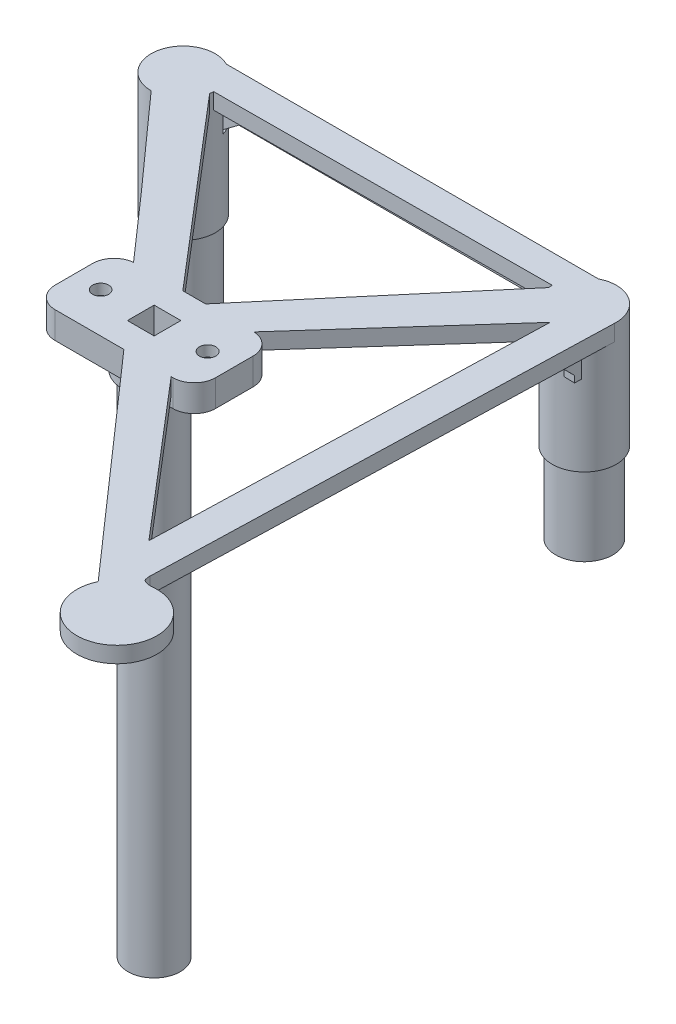
from build123d import *
from build123d.topology import SkipClean

# Parameters (mm, degrees)
EXTRUDE_1_DEPTH          = 3
SKETCH_2_R               = 5.35
EXTRUDE_2_DEPTH          = 23
CUT_EXTRUDE_1_DEPTH      = 3
SKETCH_4_R               = 5
EXTRUDE_3_DEPTH          = 100
EXTRUDE_START            = 3
SKETCH_5_R               = 5
EXTRUDE_4_DEPTH          = 3
SKETCH_6_R               = 5.35
EXTRUDE_5_DEPTH          = 5
SKETCH_7_R               = 5.35
EXTRUDE_6_DEPTH          = 5
SKETCH_8_W               = 75
SKETCH_8_H               = 10.7
EXTRUDE_7_DEPTH          = 3
EXTRUDE_8_DEPTH          = 3
CUT_EXTRUDE_2_DEPTH      = 3
SKETCH_12_R              = 6
EXTRUDE_10_DEPTH         = 13
SKETCH_13_R              = 3
CUT_EXTRUDE_3_DEPTH      = 23
SKETCH_14_R              = 3.125
CUT_EXTRUDE_5_DEPTH      = 100
SKETCH_15_R              = 6
SKETCH_15_R_2            = 5.35
EXTRUDE_11_DEPTH         = 5
SKETCH_16_R              = 6
SKETCH_16_R_2            = 3
EXTRUDE_12_DEPTH         = 5
SKETCH_17_R              = 5.35
SKETCH_17_R_2            = 3
EXTRUDE_13_DEPTH         = 5
SKETCH_18_R              = 5.35
SKETCH_18_R_2            = 3
EXTRUDE_14_DEPTH         = 5
SKETCH_20_R              = 6
SKETCH_20_R_2            = 5.35
EXTRUDE_15_DEPTH         = 5
SKETCH_21_R              = 6
SKETCH_21_R_2            = 5.35
EXTRUDE_16_DEPTH         = 5
SKETCH_22_R              = 5.35
SKETCH_22_R_2            = 3
EXTRUDE_17_DEPTH         = 5
SKETCH_23_R              = 5.35
SKETCH_23_R_2            = 3
EXTRUDE_18_DEPTH         = 5
SKETCH_25_R              = 7.5
EXTRUDE_20_DEPTH         = 3
EXTRUDE_21_DEPTH         = 3
EXTRUDE_23_DEPTH         = 3
SKETCH_30_R              = 7.5
EXTRUDE_24_DEPTH         = 3
FILLET_1_R               = 3
EXTRUDE_29_DEPTH         = 5
EXTRUDE_31_DEPTH         = 2
SKETCH_50_R              = 5.998205811
EXTRUDE_32_DEPTH         = 103
CUT_EXTRUDE_START        = -95
SKETCH_52_R              = 5.998205811
SKETCH_52_R_2            = 4.9
CUT_EXTRUDE_7_DEPTH      = 95
CUT_EXTRUDE_START_2      = -44
SKETCH_53_R              = 4.9
CUT_EXTRUDE_8_DEPTH      = 44
SKETCH_54_R              = 1.5
EXTRUDE_33_DEPTH         = 5
CUT_EXTRUDE_9_DEPTH      = 56
CUT_EXTRUDE_START_3      = -6
SKETCH_56_R              = 1.5
CUT_EXTRUDE_10_DEPTH     = 6
SKETCH_57_R              = 15
EXTRUDE_34_DEPTH         = 3
SKETCH_58_R              = 4.9
EXTRUDE_35_DEPTH         = 51
CUT_EXTRUDE_11_DEPTH     = 5
SKETCH_60_R              = 2.75
CUT_EXTRUDE_12_DEPTH     = 46
SKETCH_61_R              = 1.5
CUT_EXTRUDE_13_DEPTH     = 9
CUT_EXTRUDE_14_DEPTH     = 1.65
SKETCH_63_R              = 1
CUT_EXTRUDE_15_DEPTH     = 1.5
PATTERN_CIRCULAR_1_COUNT = 8
SKETCH_64_R              = 3.175426481
CUT_EXTRUDE_17_DEPTH     = 5
CUT_EXTRUDE_18_DEPTH     = 56
FILLET_2_R               = 1
EXTRUDE_36_DEPTH         = 5
SKETCH_67_R              = 1.5
CUT_EXTRUDE_19_DEPTH     = 5
FILLET_3_R               = 1
SKETCH_69_R              = 4.9
EXTRUDE_37_DEPTH         = 3
CUT_EXTRUDE_20_DEPTH     = 3
CUT_EXTRUDE_21_DEPTH     = 3
SKETCH_71_R              = 2.9
CUT_EXTRUDE_22_DEPTH     = 46
FILLET_4_R               = 1
SKETCH_72_R              = 1.742227019
CUT_EXTRUDE_23_DEPTH     = 3
SKETCH_73_R              = 4.9
CUT_EXTRUDE_24_DEPTH     = 10
EXTRUDE_START_2          = -59
SKETCH_74_R              = 4.9
EXTRUDE_38_DEPTH         = 59
SKETCH_75_W              = 5
SKETCH_75_H              = 5
CUT_EXTRUDE_25_DEPTH     = 59
SKETCH_76_R              = 4.9
SKETCH_76_W              = 5
SKETCH_76_H              = 5
EXTRUDE_39_DEPTH         = 44
SKETCH_77_R              = 19.817326089
CUT_EXTRUDE_27_DEPTH     = 64
SKETCH_78_W              = 30
SKETCH_78_H              = 15
EXTRUDE_40_DEPTH         = 5
FILLET_5_R               = 4
CUT_EXTRUDE_28_DEPTH     = 3
SKETCH_81_R              = 1.5
SKETCH_81_R_2            = 1.524054251
CUT_EXTRUDE_29_DEPTH     = 3
SKETCH_83_W              = 5
SKETCH_83_H              = 5
CUT_EXTRUDE_30_DEPTH     = 5


with BuildPart() as part:
    # 草图1 → 凸台-拉伸1 (new body)
    with BuildSketch(Plane(origin=(0, 0, 0), x_dir=(1, 0, 0), z_dir=(0, 1, 0))):
        Polygon((-18.65535641, 0), (18.84464359, -42.930983399), (56.34464359, 0), align=None)
    extrude(amount=EXTRUDE_1_DEPTH)

    # 草图2 → 凸台-拉伸2 (add)
    with BuildSketch(Plane(origin=(0, 3, 0), x_dir=(1, 0, 0), z_dir=(0, 1, 0))):
        with Locations(Location((56.34464359, 0, 0), (0, 0, 270))):
            Circle(SKETCH_2_R)
        with Locations(Location((-18.65535641, 0, 0), (0, 0, 270))):
            Circle(SKETCH_2_R)
    extrude(amount=-EXTRUDE_2_DEPTH)

    # 草图3 → 切除-拉伸1 (cut)
    with BuildSketch(Plane.XZ):
        Polygon((8.632668758, 17.559374543), (1.15609776, 9), (33.75905687, 9), (36.53318942, 9), (29.056618422, 17.559374543), (18.84464359, 29.25031113), align=None)
    extrude(amount=-CUT_EXTRUDE_1_DEPTH, mode=Mode.SUBTRACT)

    # 草图4 → 凸台-拉伸3 (add)
    with BuildSketch(Plane.XZ):
        with Locations(Location((18.84464359, 42.930983399, 0), (0, 0, 228.862949093))):
            Circle(SKETCH_4_R)
    extrude(amount=EXTRUDE_3_DEPTH)

    # 草图5 → 凸台-拉伸4 (add)
    with BuildSketch(Plane(origin=(0, 0, 0), x_dir=(1, 0, 0), z_dir=(0, 1, 0)).offset(EXTRUDE_START)):
        with Locations(Location((18.84464359, -42.930983399, 0), (0, 0, 131.137050907))):
            Circle(SKETCH_5_R)
    extrude(amount=-EXTRUDE_4_DEPTH)

    # 草图6 → 凸台-拉伸5 (add)
    with SkipClean():  # the faces are left unmerged after this step: merging them gives an invalid solid
        with BuildSketch(Plane.XZ.offset(20)):
            with Locations(Location((56.34464359, 0, 0), (0, 0, 131.137050907))):
                Circle(SKETCH_6_R)
        extrude(amount=EXTRUDE_5_DEPTH)
    add(part.part.scale(1), mode=Mode.REPLACE)  # the faces are merged on a copy

    # 草图7 → 凸台-拉伸6 (add)
    with BuildSketch(Plane.XZ.offset(20)):
        with Locations(Location((-18.65535641, 0, 0), (0, 0, 48.862949093))):
            Circle(SKETCH_7_R)
    extrude(amount=EXTRUDE_6_DEPTH)

    # 草图8 → 凸台-拉伸7 (add)
    with SkipClean():  # the faces are left unmerged after this step: merging them gives an invalid solid
        with BuildSketch(Plane(origin=(0, 3, 0), x_dir=(1, 0, 0), z_dir=(0, 1, 0))):
            with Locations((18.84464359, 0)):
                Rectangle(SKETCH_8_W, SKETCH_8_H)
        extrude(amount=-EXTRUDE_7_DEPTH)

    # 草图9 → 凸台-拉伸8 (add)
    with SkipClean():  # the faces are left unmerged after this step: merging them gives an invalid solid
        with BuildSketch(Plane(origin=(0, 3, 0), x_dir=(1, 0, 0), z_dir=(0, 1, 0))):
            Polygon((61.69464359, 0), (18.84464359, -47.930983399), (-24.00535641, 0), align=None)
        extrude(amount=-EXTRUDE_8_DEPTH)

    # 草图10 → 切除-拉伸2 (cut)
    with SkipClean():  # the faces are left unmerged after this step: merging them gives an invalid solid
        with BuildSketch(Plane.XZ):
            Polygon((18.84464359, 37.930983399), (-13.313716495, 0.298969924), (50.99464359, 0), align=None)
        extrude(amount=-CUT_EXTRUDE_2_DEPTH, mode=Mode.SUBTRACT)

    # 草图12 → 凸台-拉伸10 (add)
    with SkipClean():  # the faces are left unmerged after this step: merging them gives an invalid solid
        with BuildSketch(Plane(origin=(0, 3, 0), x_dir=(1, 0, 0), z_dir=(0, 1, 0))):
            with Locations(Location((-18.65535641, 0, 0), (0, 0, 270))):
                Circle(SKETCH_12_R)
            with Locations(Location((56.34464359, 0, 0), (0, 0, 270))):
                Circle(SKETCH_12_R)
        extrude(amount=-EXTRUDE_10_DEPTH)

    # 草图13 → 切除-拉伸3 (cut)
    with SkipClean():  # the faces are left unmerged after this step: merging them gives an invalid solid
        with BuildSketch(Plane.XZ.offset(25)):
            with Locations(Location((-18.65535641, 0, 0), (0, 0, 270))):
                Circle(SKETCH_13_R)
            with Locations(Location((56.34464359, 0, 0), (0, 0, 270))):
                Circle(SKETCH_13_R)
        extrude(amount=-CUT_EXTRUDE_3_DEPTH, mode=Mode.SUBTRACT)

    # 草图14 → 切除-拉伸5 (cut)
    with SkipClean():  # the faces are left unmerged after this step: merging them gives an invalid solid
        with BuildSketch(Plane.XZ.offset(100)):
            with Locations(Location((18.84464359, 42.930983399, 0), (0, 0, 270))):
                Circle(SKETCH_14_R)
        extrude(amount=-CUT_EXTRUDE_5_DEPTH, mode=Mode.SUBTRACT)

    # 草图15 → 凸台-拉伸11 (add)
    with SkipClean():  # the faces are left unmerged after this step: merging them gives an invalid solid
        with BuildSketch(Plane.XZ.offset(10)):
            with Locations(Location((56.34464359, 0, 0), (0, 0, 90.133194259))):
                Circle(SKETCH_15_R)
            with Locations(Location((56.34464359, 0, 0), (0, 0, 270))):
                Circle(SKETCH_15_R_2, mode=Mode.SUBTRACT)
        extrude(amount=EXTRUDE_11_DEPTH)

    # 草图16 → 凸台-拉伸12 (add)
    with SkipClean():  # the faces are left unmerged after this step: merging them gives an invalid solid
        with BuildSketch(Plane.XZ.offset(10)):
            with Locations(Location((-18.65535641, 0, 0), (0, 0, 89.866805741))):
                Circle(SKETCH_16_R)
            with Locations(Location((-18.65535641, 0, 0), (0, 0, 270))):
                Circle(SKETCH_16_R_2, mode=Mode.SUBTRACT)
        extrude(amount=EXTRUDE_12_DEPTH)

    # 草图17 → 凸台-拉伸13 (add)
    with SkipClean():  # the faces are left unmerged after this step: merging them gives an invalid solid
        with BuildSketch(Plane.XZ.offset(25)):
            with Locations(Location((-18.65535641, 0, 0), (0, 0, 270))):
                Circle(SKETCH_17_R)
            with Locations(Location((-18.65535641, 0, 0), (0, 0, 270))):
                Circle(SKETCH_17_R_2, mode=Mode.SUBTRACT)
        extrude(amount=EXTRUDE_13_DEPTH)

    # 草图18 → 凸台-拉伸14 (add)
    with SkipClean():  # the faces are left unmerged after this step: merging them gives an invalid solid
        with BuildSketch(Plane.XZ.offset(25)):
            with Locations(Location((56.34464359, 0, 0), (0, 0, 270))):
                Circle(SKETCH_18_R)
            with Locations(Location((56.34464359, 0, 0), (0, 0, 270))):
                Circle(SKETCH_18_R_2, mode=Mode.SUBTRACT)
        extrude(amount=EXTRUDE_14_DEPTH)

    # 草图20 → 凸台-拉伸15 (add)
    with SkipClean():  # the faces are left unmerged after this step: merging them gives an invalid solid
        with BuildSketch(Plane.XZ.offset(15)):
            with Locations(Location((-18.65535641, 0, 0), (0, 0, 89.866805741))):
                Circle(SKETCH_20_R)
            with Locations(Location((-18.65535641, 0, 0), (0, 0, 270))):
                Circle(SKETCH_20_R_2, mode=Mode.SUBTRACT)
        extrude(amount=EXTRUDE_15_DEPTH)

    # 草图21 → 凸台-拉伸16 (add)
    with SkipClean():  # the faces are left unmerged after this step: merging them gives an invalid solid
        with BuildSketch(Plane.XZ.offset(15)):
            with Locations(Location((56.34464359, 0, 0), (0, 0, 90.133194259))):
                Circle(SKETCH_21_R)
            with Locations(Location((56.34464359, 0, 0), (0, 0, 270))):
                Circle(SKETCH_21_R_2, mode=Mode.SUBTRACT)
        extrude(amount=EXTRUDE_16_DEPTH)

    # 草图22 → 凸台-拉伸17 (add)
    with SkipClean():  # the faces are left unmerged after this step: merging them gives an invalid solid
        with BuildSketch(Plane.XZ.offset(30)):
            with Locations(Location((-18.65535641, 0, 0), (0, 0, 270))):
                Circle(SKETCH_22_R)
            with Locations(Location((-18.65535641, 0, 0), (0, 0, 270))):
                Circle(SKETCH_22_R_2, mode=Mode.SUBTRACT)
        extrude(amount=EXTRUDE_17_DEPTH)

    # 草图23 → 凸台-拉伸18 (add)
    with SkipClean():  # the faces are left unmerged after this step: merging them gives an invalid solid
        with BuildSketch(Plane.XZ.offset(30)):
            with Locations(Location((56.34464359, 0, 0), (0, 0, 270))):
                Circle(SKETCH_23_R)
            with Locations(Location((56.34464359, 0, 0), (0, 0, 270))):
                Circle(SKETCH_23_R_2, mode=Mode.SUBTRACT)
        extrude(amount=EXTRUDE_18_DEPTH)

    # 草图25 → 凸台-拉伸20 (add)
    with SkipClean():  # the faces are left unmerged after this step: merging them gives an invalid solid
        with BuildSketch(Plane(origin=(0, 3, 0), x_dir=(1, 0, 0), z_dir=(0, 1, 0))):
            with Locations((18.84464359, -42.930983399)):
                Circle(SKETCH_25_R)
        extrude(amount=-EXTRUDE_20_DEPTH)

    # 草图28 → 凸台-拉伸21 (add)
    with SkipClean():  # the faces are left unmerged after this step: merging them gives an invalid solid
        with BuildSketch(Plane(origin=(0, 3, 0), x_dir=(1, 0, 0), z_dir=(0, 1, 0))):
            Polygon((-3.379636645, -23.071435978), (2.093554995, -18.328702995), (68.652557408, -96.216669577), (66.868599364, -97.910067347), (64.321605904, -100.026810209), align=None)
        extrude(amount=-EXTRUDE_21_DEPTH)

    # 草图29 → 凸台-拉伸23 (add)
    with SkipClean():  # the faces are left unmerged after this step: merging them gives an invalid solid
        with BuildSketch(Plane(origin=(0, 3, 0), x_dir=(1, 0, 0), z_dir=(0, 1, 0))):
            Polygon((56.34464359, 0), (53.74105837, -88), (59.74105837, -88), (62.34464359, 0), align=None)
        extrude(amount=-EXTRUDE_23_DEPTH)

    # 草图30 → 凸台-拉伸24 (add)
    with SkipClean():  # the faces are left unmerged after this step: merging them gives an invalid solid
        with BuildSketch(Plane(origin=(0, 3, 0), x_dir=(1, 0, 0), z_dir=(0, 1, 0))):
            with Locations((62.6531538, -93.694621783)):
                Circle(SKETCH_30_R)
        extrude(amount=-EXTRUDE_24_DEPTH)

    # 圆角1
    # the kernel refuses this fillet: 3 mm, written as the material it adds along each edge
    with BuildSketch(Plane(origin=(60.387632696, 0, 86.544977448), x_dir=(-0.6496534253779116, 0, -0.760230509052844), z_dir=(0, 1, 0))) as fillet_1_piece_1:
        with BuildLine():
            CenterArc((1.763131122, -3), FILLET_1_R, 90, 55.663998218)
            ThreePointArc((-0.714100998, -1.307864951), (-0.324488751, -0.671711358), (0, 0))
            Line((0, 0), (1.763131122, 0))
        make_face()
    extrude(amount=3)
    with BuildSketch(Plane(origin=(59.804303017, 0, 85.862359607), x_dir=(0.02957325513951661, 0, -0.9995626156376863), z_dir=(0, 1, 0))) as fillet_1_piece_2:
        with BuildLine():
            CenterArc((FILLET_1_R * 0.38596961824, -FILLET_1_R), FILLET_1_R, 90, 42.210146514)
            Line((-FILLET_1_R * 0.285882149698, -FILLET_1_R * 0.259314370385), (0, 0))
            Line((0, 0), (FILLET_1_R * 0.38596961824, 0))
        make_face()
    extrude(amount=3)

    # 草图31 → 凸台-拉伸29 (add)
    with BuildSketch(Plane.XZ):
        Polygon((-14.723586471, -1.628179316), (-14.723586471, -3.628179316), (53.527409972, -3.628179316), (53.82491501, -1.628179316), align=None)
        Polygon((49.609847968, 80.102545011), (51.130308987, 78.80323816), (22.318773999, 45.087710689), (20.798312981, 46.38701754), align=None)
        Polygon((-15.349607435, 4.086383285), (-13.829146417, 2.787076434), (17.097273349, 38.977461836), (15.576812331, 40.276768687), align=None)
        Polygon((20.325894576, 39.186783249), (51.86894969, 1.971881231), (53.394639731, 3.265043982), (21.851584617, 40.479945999), align=None)
        Polygon((56.093860655, 78.864293565), (58.318881117, 3.659610745), (60.319756269, 3.659610745), (58.092985887, 78.923440075), align=None)
    extrude(amount=EXTRUDE_29_DEPTH)

    # 切除-扫描1: sweep along a path in 草图36
    with BuildLine(Plane.XZ.offset(5)) as sweep_1_path:
        Line((18.84464359, -3.628179316), (18.84464359, -1.628179316))
    # 草图35 → 切除-扫描1 (sweep, cut)
    with BuildSketch(Plane(origin=(0, 0, -3.628179316), x_dir=(-1, 0, 0), z_dir=(0, 0, -1))):
        Polygon((13.876620714, -5), (9.876620714, -2), (-47.565907894, -2), (-51.565907894, -5), align=None)
    sweep(path=sweep_1_path.line, mode=Mode.SUBTRACT)

    # 切除-扫描3: sweep along a path in 草图38
    with BuildLine(Plane.XZ.offset(5)) as sweep_3_path:
        Line((59.19369399, 41.720005215), (57.192818839, 41.720005215))
    # 草图37 → 切除-扫描3 (sweep, cut)
    with BuildSketch(Plane(origin=(60.375181238, 0, 1.786271926), x_dir=(0.029573255139513054, 0, -0.9995626156376864), z_dir=(0.9995626156376866, 0, 0.029573255139513057))):
        Polygon((-2.73149314, -5), (-6.73149314, -1), (-73.170921503, -1), (-77.170921503, -5), align=None)
    sweep(path=sweep_3_path.line, mode=Mode.SUBTRACT)

    # 草图39 → 凸台-拉伸31 (add)
    with BuildSketch(Plane(origin=(58.376056006, 0, 1.727125416), x_dir=(0.02957325513951297, 0, -0.9995626156376864), z_dir=(0.9995626156376866, 0, 0.029573255139512974))):
        Polygon((-3.961044, -3.829621531), (-3.961044, -5), (-2.73149314, -5), (-2.73149314, -4.501704435), (-3.961044, -3.272153575), align=None)
    extrude(amount=EXTRUDE_31_DEPTH)

    # 切除-扫描5: sweep along a path in 草图42
    with BuildLine(Plane.XZ.offset(5)) as sweep_5_path:
        Line((0.095091388, 22.159914171), (1.552120507, 20.786378718))
    # 草图40 → 切除-扫描5 (sweep, cut)
    with BuildSketch(Plane(origin=(-10.889521113, 0, 9.305617977), x_dir=(0.6496534253779145, 0, 0.7602305090528415), z_dir=(-0.7602305090528415, 0, 0.6496534253779145))):
        Polygon((-5.121187346, -5), (-3.121187346, -1), (36.9380259, -1), (38.9380259, -5), align=None)
    sweep(path=sweep_5_path.line, mode=Mode.SUBTRACT)

    # 切除-扫描6: sweep along a path in 草图44
    with BuildLine(Plane.XZ.offset(5)) as sweep_6_path:
        Line((36.035656698, 20.652203895), (37.472857905, 22.049766909))
    # 草图43 → 切除-扫描6 (sweep, cut)
    with BuildSketch(Plane(origin=(31.1568423, 0, 26.408291855), x_dir=(-0.6465813751887421, 0, 0.7628450204720715), z_dir=(-0.7628450204720715, 0, -0.6465813751887421))):
        Polygon((14.734624595, -5), (12.734624595, -1), (-27.825731715, -1), (-29.825731715, -5), align=None)
    sweep(path=sweep_6_path.line, mode=Mode.SUBTRACT)

    # 切除-扫描7: sweep along a path in 草图47
    with BuildLine(Plane.XZ.offset(5)) as sweep_7_path:
        Line((37.03221924, 62.305521799), (35.511758222, 63.60482865))
    # 草图46 → 切除-扫描7 (sweep, cut)
    with BuildSketch(Plane(origin=(-10.889521113, 0, 9.305617977), x_dir=(0.6496534253779142, 0, 0.7602305090528417), z_dir=(-0.7602305090528417, 0, 0.6496534253779142))):
        Polygon((50.821835343, -5), (52.821835343, -1), (88.125606235, -1), (93.125606235, 0), (93.125606235, -5), align=None)
    sweep(path=sweep_7_path.line, mode=Mode.SUBTRACT)

    # 切除-扫描8: sweep along a path in 草图49
    with BuildLine(Plane.XZ.offset(1)) as sweep_8_path:
        Line((58.211278907, 74.925189613), (56.210403756, 74.925189613))
        Line((56.210403756, 74.925189613), (55.379994456, 74.925189613))
    # 草图48 → 切除-扫描8 (sweep, cut)
    with BuildSketch(Plane(origin=(60.375181238, 0, 1.786271926), x_dir=(0.029573255139513054, 0, -0.9995626156376864), z_dir=(0.9995626156376866, 0, 0.029573255139513057))):
        Polygon((-73.170921503, -1), (-77.170921503, 0), (-77.170921503, -5), align=None)
    sweep(path=sweep_8_path.line, mode=Mode.SUBTRACT)

    # 草图50 → 凸台-拉伸32 (add)
    with BuildSketch(Plane(origin=(0, 3, 0), x_dir=(1, 0, 0), z_dir=(0, 1, 0))):
        with Locations(Location((18.84464359, -42.930983399, 0), (0, 0, 270))):
            Circle(SKETCH_50_R)
    extrude(amount=-EXTRUDE_32_DEPTH)

    # 草图52 → 切除-拉伸7 (cut)
    with BuildSketch(Plane.XZ.offset(100).offset(CUT_EXTRUDE_START)):
        with Locations((18.84464359, 42.930983399)):
            Circle(SKETCH_52_R)
        with Locations(Location((18.84464359, 42.930983399, 0), (0, 0, 270))):
            Circle(SKETCH_52_R_2, mode=Mode.SUBTRACT)
    extrude(amount=CUT_EXTRUDE_7_DEPTH, mode=Mode.SUBTRACT)

    # 草图53 → 切除-拉伸8 (cut)
    with BuildSketch(Plane.XZ.offset(100).offset(CUT_EXTRUDE_START_2)):
        with Locations(Location((18.84464359, 42.930983399, 0), (0, 0, 270))):
            Circle(SKETCH_53_R)
    extrude(amount=CUT_EXTRUDE_8_DEPTH, mode=Mode.SUBTRACT)

    # 草图54 → 凸台-拉伸33 (add)
    with BuildSketch(Plane.XZ.offset(56)):
        Polygon((22.020070071, 42.930983399), (20.43235683, 45.680983399), (17.25693035, 45.680983399), (15.669217109, 42.930983399), (17.25693035, 40.180983399), (20.43235683, 40.180983399), align=None)
        with Locations(Location((18.84464359, 42.930983399, 0), (0, 0, 270))):
            Circle(SKETCH_54_R, mode=Mode.SUBTRACT)
    extrude(amount=EXTRUDE_33_DEPTH)

    # 草图55 → 切除-拉伸9 (cut)
    with BuildSketch(Plane(origin=(0, 3, 0), x_dir=(1, 0, 0), z_dir=(0, 1, 0))):
        Polygon((22.077805097, -42.930983399), (20.461224344, -40.130983399), (17.228062836, -40.130983399), (15.611482083, -42.930983399), (17.228062836, -45.730983399), (20.461224344, -45.730983399), align=None)
    extrude(amount=-CUT_EXTRUDE_9_DEPTH, mode=Mode.SUBTRACT)

    # 草图56 → 切除-拉伸10 (cut)
    with BuildSketch(Plane.XZ.offset(56).offset(CUT_EXTRUDE_START_3)):
        with Locations(Location((18.84464359, 42.930983399, 0), (0, 0, 90))):
            Circle(SKETCH_56_R)
    extrude(amount=CUT_EXTRUDE_10_DEPTH, mode=Mode.SUBTRACT)

    # 草图64 → 切除-拉伸17 (cut)
    with BuildSketch(Plane.XZ.offset(61)):
        with Locations((18.84464359, 42.930983399)):
            Circle(SKETCH_64_R)
    extrude(amount=-CUT_EXTRUDE_17_DEPTH, mode=Mode.SUBTRACT)

    # 草图65 → 切除-拉伸18 (cut)
    with BuildSketch(Plane(origin=(0, 3, 0), x_dir=(1, 0, 0), z_dir=(0, 1, 0))):
        Polygon((22.251010178, -42.930983399), (20.547826884, -39.980983399), (17.141460296, -39.980983399), (15.438277002, -42.930983399), (17.141460296, -45.880983399), (20.547826884, -45.880983399), align=None)
    extrude(amount=-CUT_EXTRUDE_18_DEPTH, mode=Mode.SUBTRACT)

    # 圆角2
    # the kernel refuses this fillet: 1 mm, written as the material it adds along each edge
    with BuildSketch(Plane(origin=(19.297826884, -53, 48.046046908), x_dir=(0, 1, 0), z_dir=(0.49999999999999994, 0, -0.8660254037844387))) as fillet_2_piece_1_section:
        with BuildLine():
            CenterArc((FILLET_2_R, -FILLET_2_R), FILLET_2_R, 90, 90)
            Line((0, -FILLET_2_R), (0, 0))
            Line((0, 0), (FILLET_2_R, 0))
        make_face()
    fillet_2_piece_1 = extrude(amount=8.406366588, mode=Mode.PRIVATE)
    fillet_2_piece_1 = split(fillet_2_piece_1, bisect_by=Plane(origin=(21.196381273, -52.783149841, 45.880983399), z_dir=(0, 0, -1)), keep=Keep.TOP, mode=Mode.PRIVATE)
    fillet_2_piece_1 = split(fillet_2_piece_1, bisect_by=Plane(origin=(22.575287373, -52.783149841, 43.492647975), z_dir=(-0.8660254037844382, 0, 0.5000000000000009)), keep=Keep.TOP, mode=Mode.PRIVATE)
    add(fillet_2_piece_1)
    with BuildSketch(Plane(origin=(14.641460296, -53, 45.880983399), x_dir=(0, 1, 0), z_dir=(1, 0, 0))) as fillet_2_piece_2_section:
        with BuildLine():
            CenterArc((FILLET_2_R, -FILLET_2_R), FILLET_2_R, 90, 90)
            Line((0, -FILLET_2_R), (0, 0))
            Line((0, 0), (FILLET_2_R, 0))
        make_face()
    fillet_2_piece_2 = extrude(amount=8.406366588, mode=Mode.PRIVATE)
    fillet_2_piece_2 = split(fillet_2_piece_2, bisect_by=Plane(origin=(20.22354969, -52.783149841, 46.442647975), z_dir=(-0.8660254037844387, 0, -0.49999999999999994)), keep=Keep.TOP, mode=Mode.PRIVATE)
    fillet_2_piece_2 = split(fillet_2_piece_2, bisect_by=Plane(origin=(17.46573749, -52.783149841, 46.442647975), z_dir=(0.8660254037844393, 0, -0.49999999999999906)), keep=Keep.TOP, mode=Mode.PRIVATE)
    add(fillet_2_piece_2)
    with BuildSketch(Plane(origin=(14.188277002, -53, 40.765919889), x_dir=(0, 1, 0), z_dir=(0.49999999999999906, 0, 0.8660254037844393))) as fillet_2_piece_3_section:
        with BuildLine():
            CenterArc((FILLET_2_R, -FILLET_2_R), FILLET_2_R, 90, 90)
            Line((0, -FILLET_2_R), (0, 0))
            Line((0, 0), (FILLET_2_R, 0))
        make_face()
    fillet_2_piece_3 = extrude(amount=8.406366588, mode=Mode.PRIVATE)
    fillet_2_piece_3 = split(fillet_2_piece_3, bisect_by=Plane(origin=(16.492905907, -52.783149841, 45.880983399), z_dir=(0, 0, -1)), keep=Keep.TOP, mode=Mode.PRIVATE)
    fillet_2_piece_3 = split(fillet_2_piece_3, bisect_by=Plane(origin=(15.113999807, -52.783149841, 43.492647975), z_dir=(0.8660254037844386, 0, 0.5000000000000002)), keep=Keep.TOP, mode=Mode.PRIVATE)
    add(fillet_2_piece_3)
    with BuildSketch(Plane(origin=(18.391460296, -53, 37.815919889), x_dir=(0, 1, 0), z_dir=(-0.5000000000000002, 0, 0.8660254037844386))) as fillet_2_piece_4_section:
        with BuildLine():
            CenterArc((FILLET_2_R, -FILLET_2_R), FILLET_2_R, 90, 90)
            Line((0, -FILLET_2_R), (0, 0))
            Line((0, 0), (FILLET_2_R, 0))
        make_face()
    fillet_2_piece_4 = extrude(amount=8.406366588, mode=Mode.PRIVATE)
    fillet_2_piece_4 = split(fillet_2_piece_4, bisect_by=Plane(origin=(15.113999807, -52.783149841, 42.369318822), z_dir=(0.8660254037844393, 0, -0.49999999999999906)), keep=Keep.TOP, mode=Mode.PRIVATE)
    fillet_2_piece_4 = split(fillet_2_piece_4, bisect_by=Plane(origin=(16.492905907, -52.783149841, 39.980983399), z_dir=(0, 0, 1)), keep=Keep.TOP, mode=Mode.PRIVATE)
    add(fillet_2_piece_4)
    with BuildSketch(Plane(origin=(23.047826884, -53, 39.980983399), x_dir=(0, 1, 0), z_dir=(-1, 0, 0))) as fillet_2_piece_5_section:
        with BuildLine():
            CenterArc((FILLET_2_R, -FILLET_2_R), FILLET_2_R, 90, 90)
            Line((0, -FILLET_2_R), (0, 0))
            Line((0, 0), (FILLET_2_R, 0))
        make_face()
    fillet_2_piece_5 = extrude(amount=8.406366588, mode=Mode.PRIVATE)
    fillet_2_piece_5 = split(fillet_2_piece_5, bisect_by=Plane(origin=(17.46573749, -52.783149841, 39.419318822), z_dir=(0.8660254037844386, 0, 0.5000000000000002)), keep=Keep.TOP, mode=Mode.PRIVATE)
    fillet_2_piece_5 = split(fillet_2_piece_5, bisect_by=Plane(origin=(20.22354969, -52.783149841, 39.419318822), z_dir=(-0.8660254037844382, 0, 0.5000000000000009)), keep=Keep.TOP, mode=Mode.PRIVATE)
    add(fillet_2_piece_5)
    with BuildSketch(Plane(origin=(23.501010178, -53, 45.096046908), x_dir=(0, 1, 0), z_dir=(-0.5000000000000009, 0, -0.8660254037844382))) as fillet_2_piece_6_section:
        with BuildLine():
            CenterArc((FILLET_2_R, -FILLET_2_R), FILLET_2_R, 90, 90)
            Line((0, -FILLET_2_R), (0, 0))
            Line((0, 0), (FILLET_2_R, 0))
        make_face()
    fillet_2_piece_6 = extrude(amount=8.406366588, mode=Mode.PRIVATE)
    fillet_2_piece_6 = split(fillet_2_piece_6, bisect_by=Plane(origin=(22.575287373, -52.783149841, 42.369318822), z_dir=(-0.8660254037844387, 0, -0.49999999999999994)), keep=Keep.TOP, mode=Mode.PRIVATE)
    fillet_2_piece_6 = split(fillet_2_piece_6, bisect_by=Plane(origin=(21.196381273, -52.783149841, 39.980983399), z_dir=(0, 0, 1)), keep=Keep.TOP, mode=Mode.PRIVATE)
    add(fillet_2_piece_6)

    # 草图69 → 凸台-拉伸37 (add)
    with BuildSketch(Plane.XZ.offset(56)):
        with Locations(Location((18.84464359, 42.930983399, 0), (0, 0, 270))):
            Circle(SKETCH_69_R)
    extrude(amount=EXTRUDE_37_DEPTH)

    # 草图68 → 切除-拉伸20 (cut)
    with BuildSketch(Plane.XZ.offset(56)):
        Polygon((17.97353008, 41.422170541), (13.94464359, 41.430983399), (15.863729909, 37.533957775), (21.64727463, 37.627802071), (23.74464359, 41.430983399), (19.7157571, 41.422170541), (20.586870609, 42.930983399), (19.7157571, 44.439796256), (23.74464359, 44.430983399), (21.991739507, 48.037279535), (15.697547673, 48.037279535), (13.94464359, 44.430983399), (17.97353008, 44.439796256), (17.102416571, 42.930983399), align=None)
    extrude(amount=CUT_EXTRUDE_20_DEPTH, mode=Mode.SUBTRACT)

    # 草图72 → 切除-拉伸23 (cut)
    with BuildSketch(Plane.XZ.offset(56)):
        with Locations((18.84464359, 42.930983399)):
            Circle(SKETCH_72_R)
    extrude(amount=CUT_EXTRUDE_23_DEPTH, mode=Mode.SUBTRACT)

    # 草图73 → 切除-拉伸24 (cut)
    with BuildSketch(Plane.XZ.offset(56)):
        with Locations(Location((18.84464359, 42.930983399, 0), (0, 0, 270))):
            Circle(SKETCH_73_R)
    extrude(amount=CUT_EXTRUDE_24_DEPTH, mode=Mode.SUBTRACT)

    # 草图74 → 凸台-拉伸38 (add)
    with BuildSketch(Plane.XZ.offset(56).offset(EXTRUDE_START_2)):
        with Locations(Location((18.84464359, 42.930983399, 0), (0, 0, 270))):
            Circle(SKETCH_74_R)
    extrude(amount=EXTRUDE_38_DEPTH)

    # 草图75 → 切除-拉伸25 (cut)
    with BuildSketch(Plane.XZ.offset(56)):
        with Locations((18.84464359, 42.930983399)):
            Rectangle(SKETCH_75_W, SKETCH_75_H)
    extrude(amount=-CUT_EXTRUDE_25_DEPTH, mode=Mode.SUBTRACT)

    # 草图76 → 凸台-拉伸39 (add)
    with BuildSketch(Plane.XZ.offset(56)):
        with Locations(Location((18.84464359, 42.930983399, 0), (0, 0, 270))):
            Circle(SKETCH_76_R)
        with Locations((18.84464359, 42.930983399)):
            Rectangle(SKETCH_76_W, SKETCH_76_H, mode=Mode.SUBTRACT)
    extrude(amount=EXTRUDE_39_DEPTH)

    # 草图78 → 凸台-拉伸40 (add)
    with BuildSketch(Plane(origin=(0, 3, 0), x_dir=(1, 0, 0), z_dir=(0, 1, 0))):
        with Locations((18.84464359, -42.930983399)):
            Rectangle(SKETCH_78_W, SKETCH_78_H)
    extrude(amount=-EXTRUDE_40_DEPTH)

    # 圆角5
    fillet_5_edges = [part.edges().sort_by_distance(p)[0] for p in [
        (3.84464359, 0.5, 35.430983399),
        (3.84464359, 0.5, 50.430983399),
        (33.84464359, 0.5, 50.430983399),
        (33.84464359, 0.5, 35.430983399),
    ]]
    fillet(fillet_5_edges, radius=FILLET_5_R)

    # 草图80 → 切除-拉伸28 (cut)
    with BuildSketch(Plane.XZ.offset(2)):
        Polygon((32.077805097, 42.930983399), (30.461224344, 45.730983399), (27.228062836, 45.730983399), (25.611482083, 42.930983399), (27.228062836, 40.130983399), (30.461224344, 40.130983399), align=None)
        Polygon((5.611482083, 42.930983399), (7.228062836, 40.130983399), (10.461224344, 40.130983399), (12.077805097, 42.930983399), (10.461224344, 45.730983399), (7.228062836, 45.730983399), align=None)
    extrude(amount=-CUT_EXTRUDE_28_DEPTH, mode=Mode.SUBTRACT)

    # 草图81 → 切除-拉伸29 (cut)
    with BuildSketch(Plane.XZ.offset(-1)):
        with Locations(Location((8.84464359, 42.930983399, 0), (0, 0, 270))):
            Circle(SKETCH_81_R)
        with Locations(Location((28.84464359, 42.930983399, 0), (0, 0, 270))):
            Circle(SKETCH_81_R_2)
    extrude(amount=-CUT_EXTRUDE_29_DEPTH, mode=Mode.SUBTRACT)

    # 草图83 → 切除-拉伸30 (cut)
    with BuildSketch(Plane.XZ.offset(2)):
        with Locations((18.84464359, 42.930983399)):
            Rectangle(SKETCH_83_W, SKETCH_83_H)
    extrude(amount=-CUT_EXTRUDE_30_DEPTH, mode=Mode.SUBTRACT)


with BuildPart() as body_2:
    # 草图57 → 凸台-拉伸34 (new body)
    with BuildSketch(Plane(origin=(0, 0, 0), x_dir=(1, 0, 0), z_dir=(0, 1, 0))):
        with Locations(Location((-1.85085497, -63.626481958, 0), (0, 0, 270))):
            Circle(SKETCH_57_R)
    extrude(amount=EXTRUDE_34_DEPTH)

    # 草图58 → 凸台-拉伸35 (add)
    with BuildSketch(Plane.XZ):
        with Locations(Location((-1.85085497, 63.626481958, 0), (0, 0, 90))):
            Circle(SKETCH_58_R)
    extrude(amount=EXTRUDE_35_DEPTH)

    # 草图59 → 切除-拉伸11 (cut)
    with BuildSketch(Plane.XZ.offset(51)):
        Polygon((1.324571511, 63.626481958), (-0.263141729, 66.376481958), (-3.43856821, 66.376481958), (-5.02628145, 63.626481958), (-3.43856821, 60.876481958), (-0.263141729, 60.876481958), align=None)
    extrude(amount=-CUT_EXTRUDE_11_DEPTH, mode=Mode.SUBTRACT)

    # 草图60 → 切除-拉伸12 (cut)
    with BuildSketch(Plane(origin=(0, 3, 0), x_dir=(1, 0, 0), z_dir=(0, 1, 0))):
        with Locations(Location((-1.85085497, -63.626481958, 0), (0, 0, 270))):
            Circle(SKETCH_60_R)
    extrude(amount=-CUT_EXTRUDE_12_DEPTH, mode=Mode.SUBTRACT)

    # 草图61 → 切除-拉伸13 (cut)
    with BuildSketch(Plane.XZ.offset(46)):
        with Locations(Location((-1.85085497, 63.626481958, 0), (0, 0, 270))):
            Circle(SKETCH_61_R)
    extrude(amount=-CUT_EXTRUDE_13_DEPTH, mode=Mode.SUBTRACT)

    # 草图62 → 切除-拉伸14 (cut)
    with BuildSketch(Plane.XZ):
        Polygon((10.516281134, 63.626481958), (9.332713082, 65.676481958), (6.965576978, 65.676481958), (5.782008927, 63.626481958), (6.965576978, 61.576481958), (9.332713082, 61.576481958), align=None)
    cut_extrude_14 = extrude(amount=-CUT_EXTRUDE_14_DEPTH, mode=Mode.SUBTRACT)

    # 草图63 → 切除-拉伸15 (cut)
    with BuildSketch(Plane.XZ.offset(-1.65)):
        with Locations(Location((8.14914503, 63.626481958, 0), (0, 0, 270))):
            Circle(SKETCH_63_R)
    cut_extrude_15 = extrude(amount=-CUT_EXTRUDE_15_DEPTH, mode=Mode.SUBTRACT)

    # 阵列(圆周)1: 切除-拉伸14, 切除-拉伸15 ×8 about axis
    pattern_circular_1_axis = Axis((-1.85085497, 0, 63.626481958), (0, 1, 0))
    add([cut_extrude_14.rotate(pattern_circular_1_axis, i * 360 / PATTERN_CIRCULAR_1_COUNT) for i in range(1, PATTERN_CIRCULAR_1_COUNT)], mode=Mode.SUBTRACT)
    add([cut_extrude_15.rotate(pattern_circular_1_axis, i * 360 / PATTERN_CIRCULAR_1_COUNT) for i in range(1, PATTERN_CIRCULAR_1_COUNT)], mode=Mode.SUBTRACT)

    # 草图66 → 凸台-拉伸36 (add)
    with BuildSketch(Plane.XZ.offset(51)):
        Polygon((1.324571511, 63.626481958), (-0.263141729, 66.376481958), (-3.43856821, 66.376481958), (-5.02628145, 63.626481958), (-3.43856821, 60.876481958), (-0.263141729, 60.876481958), align=None)
    extrude(amount=-EXTRUDE_36_DEPTH)

    # 草图67 → 切除-拉伸19 (cut)
    with BuildSketch(Plane.XZ.offset(51)):
        with Locations(Location((-1.85085497, 63.626481958, 0), (0, 0, 270))):
            Circle(SKETCH_67_R)
    extrude(amount=-CUT_EXTRUDE_19_DEPTH, mode=Mode.SUBTRACT)

    # 圆角3
    fillet_3_edges = [body_2.edges().sort_by_distance(p)[0] for p in [
        (-1.85085497, -43, 60.876481958),
    ]]
    fillet(fillet_3_edges, radius=FILLET_3_R)

    # 草图70 → 切除-拉伸21 (cut)
    with BuildSketch(Plane.XZ.offset(51)):
        Polygon((-2.716880374, 65.126481958), (-0.984829566, 65.126481958), (3.220078331, 65.126481958), (3.220078331, 62.126481958), (-0.984829566, 62.126481958), (-2.716880374, 62.126481958), (-7.47972899, 62.126481958), (-7.47972899, 65.126481958), align=None)
    extrude(amount=-CUT_EXTRUDE_21_DEPTH, mode=Mode.SUBTRACT)

    # 草图71 → 切除-拉伸22 (cut)
    with BuildSketch(Plane(origin=(0, 3, 0), x_dir=(1, 0, 0), z_dir=(0, 1, 0))):
        with Locations(Location((-1.85085497, -63.626481958, 0), (0, 0, 270))):
            Circle(SKETCH_71_R)
    extrude(amount=-CUT_EXTRUDE_22_DEPTH, mode=Mode.SUBTRACT)

    # 圆角4
    fillet_4_edges = [body_2.edges().sort_by_distance(p)[0] for p in [
        (-1.85085497, -43, 60.726481958),
    ]]
    fillet(fillet_4_edges, radius=FILLET_4_R)

    # 草图77 → 切除-拉伸27 (cut)
    with BuildSketch(Plane(origin=(0, 3, 0), x_dir=(1, 0, 0), z_dir=(0, 1, 0))):
        with Locations((-1.85085497, -63.626481958)):
            Circle(SKETCH_77_R)
    extrude(amount=-CUT_EXTRUDE_27_DEPTH, mode=Mode.SUBTRACT)


solid = part.part
